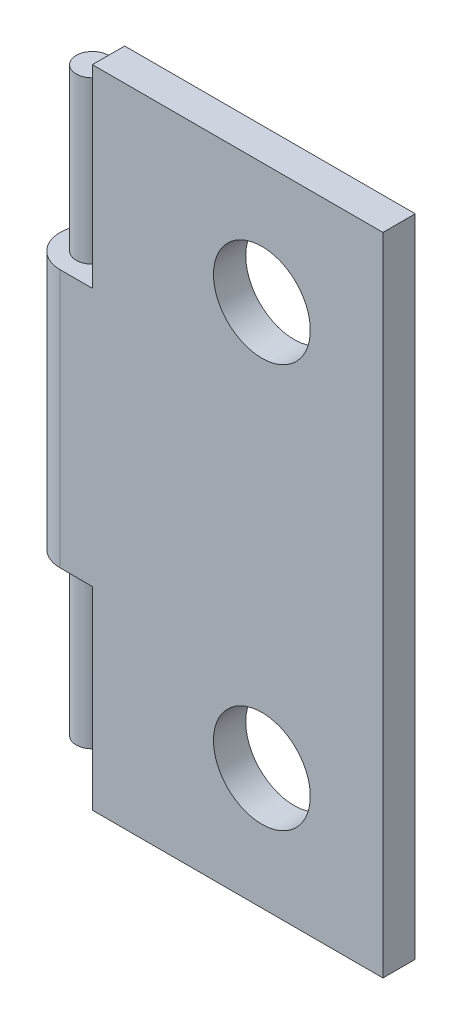
from build123d import *

# Parameters (mm, degrees)
EXTRUDE_1_DEPTH          = 40
CUT_EXTRUDE_1_DEPTH      = 40
CUT_EXTRUDE_1_DEPTH_BACK = 40
SKETCH_2_W               = 4
SKETCH_2_H               = 12
EXTRUDE_2_DEPTH          = 10
EXTRUDE_START            = 10
EXTRUDE_3_DEPTH          = 10
SKETCH_5_R               = 3
CUT_EXTRUDE_2_DEPTH      = 10


with BuildPart() as part:
    # 草图1 → 凸台-拉伸1 (new body)
    with BuildSketch(Plane(origin=(0, 0, 0), x_dir=(1, 0, 0), z_dir=(0, 1, 0))):
        with BuildLine():
            Line((10, 1), (-8, 1))
            ThreePointArc((-8, 1), (-11.414213562, 2.414213562), (-10, -1))
            Line((-10, -1), (10, -1))
            Line((10, -1), (10, 1))
        make_face()
    extrude(amount=EXTRUDE_1_DEPTH)

    # 草图2 → 切除-拉伸1 (cut, two sides: drawn at the far end of the back side and taken through both)
    with BuildSketch(Plane(origin=(0, 0, -1), x_dir=(-1, 0, 0), z_dir=(0, 0, -1)).offset(-CUT_EXTRUDE_1_DEPTH_BACK)):
        with Locations((10, 6)):
            Rectangle(SKETCH_2_W, SKETCH_2_H)
        with Locations((10, 34)):
            Rectangle(SKETCH_2_W, SKETCH_2_H)
    extrude(amount=CUT_EXTRUDE_1_DEPTH + CUT_EXTRUDE_1_DEPTH_BACK, mode=Mode.SUBTRACT)

    # 草图3 → 凸台-拉伸2 (add)
    with BuildSketch(Plane(origin=(0, 12, 0), x_dir=(-1, 0, 0), z_dir=(0, -1, 0))):
        with BuildLine():
            ThreePointArc((9, 1), (10, 0), (11, 1))
            ThreePointArc((11, 1), (10, 2), (9, 1))
        make_face()
    extrude(amount=EXTRUDE_2_DEPTH)

    # 草图4 → 凸台-拉伸3 (add)
    with BuildSketch(Plane(origin=(0, 28, 0), x_dir=(1, 0, 0), z_dir=(0, 1, 0)).offset(EXTRUDE_START)):
        with BuildLine():
            ThreePointArc((-10, 2), (-10.707106781, 0.292893219), (-9, 1))
            ThreePointArc((-9, 1), (-9.292893219, 1.707106781), (-10, 2))
        make_face()
    extrude(amount=-EXTRUDE_3_DEPTH)

    # 草图5 → 切除-拉伸2 (cut)
    with BuildSketch(Plane(origin=(0, 0, -1), x_dir=(-1, 0, 0), z_dir=(0, 0, -1))):
        with Locations((-2.5, 32.5)):
            Circle(SKETCH_5_R)
        with Locations((-2.5, 7.5)):
            Circle(SKETCH_5_R)
    extrude(amount=-CUT_EXTRUDE_2_DEPTH, mode=Mode.SUBTRACT)


solid = part.part
